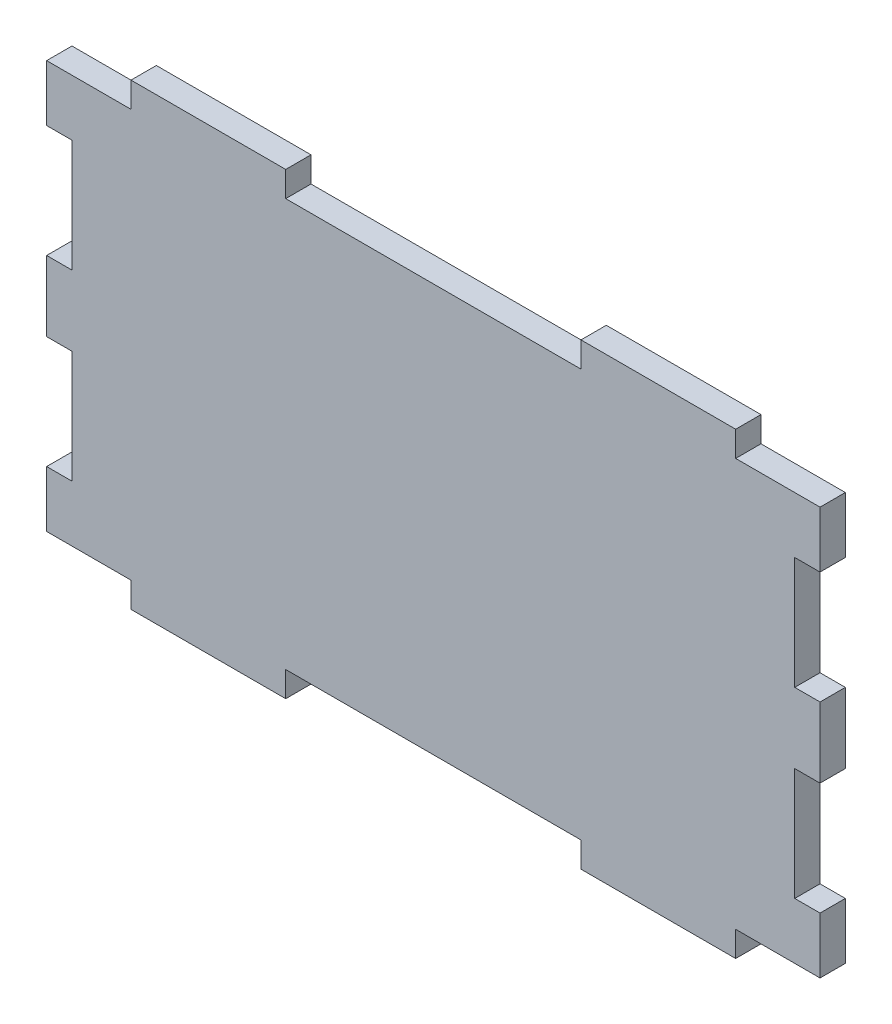
from build123d import *

# Parameters (mm, degrees)
SKETCH_1_W             = 110
SKETCH_1_H             = 58
SM_BASE_FLANGE_1_DEPTH = 3.6
CUT_EXTRUDE_1_REACH    = 126.406
SKETCH_2_W             = 3.6
SKETCH_2_H             = 16
SKETCH_3_W             = 22
SKETCH_3_H             = 3.6
EXTRUDE_1_DEPTH        = 3.6


# Sheet-metal steps are written as plain solids
with BuildPart() as part:
    # Sketch 1 → Базовая кромка1 (new body)
    with BuildSketch(Plane.XY):
        with Locations((55, 29)):
            Rectangle(SKETCH_1_W, SKETCH_1_H)
    extrude(amount=-SM_BASE_FLANGE_1_DEPTH)

    # Sketch 2 → Вырез-Вытянуть1 (cut, up to next)
    with BuildSketch(Plane(origin=(0, 0, -3.6), x_dir=(-1, 0, 0), z_dir=(0, 0, -1)), mode=Mode.PRIVATE) as cut_extrude_1_sk1:
        with Locations((-108.2, 42)):
            Rectangle(SKETCH_2_W, SKETCH_2_H)
    cut_extrude_1_tool1 = extrude(cut_extrude_1_sk1.sketch, amount=-CUT_EXTRUDE_1_REACH, mode=Mode.PRIVATE) & part.part
    # Sketch 2 → Вырез-Вытянуть1 (cut, up to next)
    with BuildSketch(Plane(origin=(0, 0, -3.6), x_dir=(-1, 0, 0), z_dir=(0, 0, -1)), mode=Mode.PRIVATE) as cut_extrude_1_sk2:
        with Locations((-108.2, 16)):
            Rectangle(SKETCH_2_W, SKETCH_2_H)
    cut_extrude_1_tool2 = extrude(cut_extrude_1_sk2.sketch, amount=-CUT_EXTRUDE_1_REACH, mode=Mode.PRIVATE) & part.part
    # Sketch 2 → Вырез-Вытянуть1 (cut, up to next)
    with BuildSketch(Plane(origin=(0, 0, -3.6), x_dir=(-1, 0, 0), z_dir=(0, 0, -1)), mode=Mode.PRIVATE) as cut_extrude_1_sk3:
        with Locations((-1.8, 16)):
            Rectangle(SKETCH_2_W, SKETCH_2_H)
    cut_extrude_1_tool3 = extrude(cut_extrude_1_sk3.sketch, amount=-CUT_EXTRUDE_1_REACH, mode=Mode.PRIVATE) & part.part
    # Sketch 2 → Вырез-Вытянуть1 (cut, up to next)
    with BuildSketch(Plane(origin=(0, 0, -3.6), x_dir=(-1, 0, 0), z_dir=(0, 0, -1)), mode=Mode.PRIVATE) as cut_extrude_1_sk4:
        with Locations((-1.8, 42)):
            Rectangle(SKETCH_2_W, SKETCH_2_H)
    cut_extrude_1_tool4 = extrude(cut_extrude_1_sk4.sketch, amount=-CUT_EXTRUDE_1_REACH, mode=Mode.PRIVATE) & part.part
    add(cut_extrude_1_tool1.solids().sort_by_distance((108.2, 42, -3.6))[0], mode=Mode.SUBTRACT)
    add(cut_extrude_1_tool2.solids().sort_by_distance((108.2, 16, -3.6))[0], mode=Mode.SUBTRACT)
    add(cut_extrude_1_tool3.solids().sort_by_distance((1.8, 16, -3.6))[0], mode=Mode.SUBTRACT)
    add(cut_extrude_1_tool4.solids().sort_by_distance((1.8, 42, -3.6))[0], mode=Mode.SUBTRACT)

    # Эскиз3 → Бобышка-Вытянуть1 (add)
    with BuildSketch(Plane.XY):
        with Locations((23, 59.8)):
            Rectangle(SKETCH_3_W, SKETCH_3_H)
        with Locations((87, 59.8)):
            Rectangle(SKETCH_3_W, SKETCH_3_H)
        with Locations((23, -1.8)):
            Rectangle(SKETCH_3_W, SKETCH_3_H)
        with Locations((87, -1.8)):
            Rectangle(SKETCH_3_W, SKETCH_3_H)
    extrude(amount=-EXTRUDE_1_DEPTH)


solid = part.part
